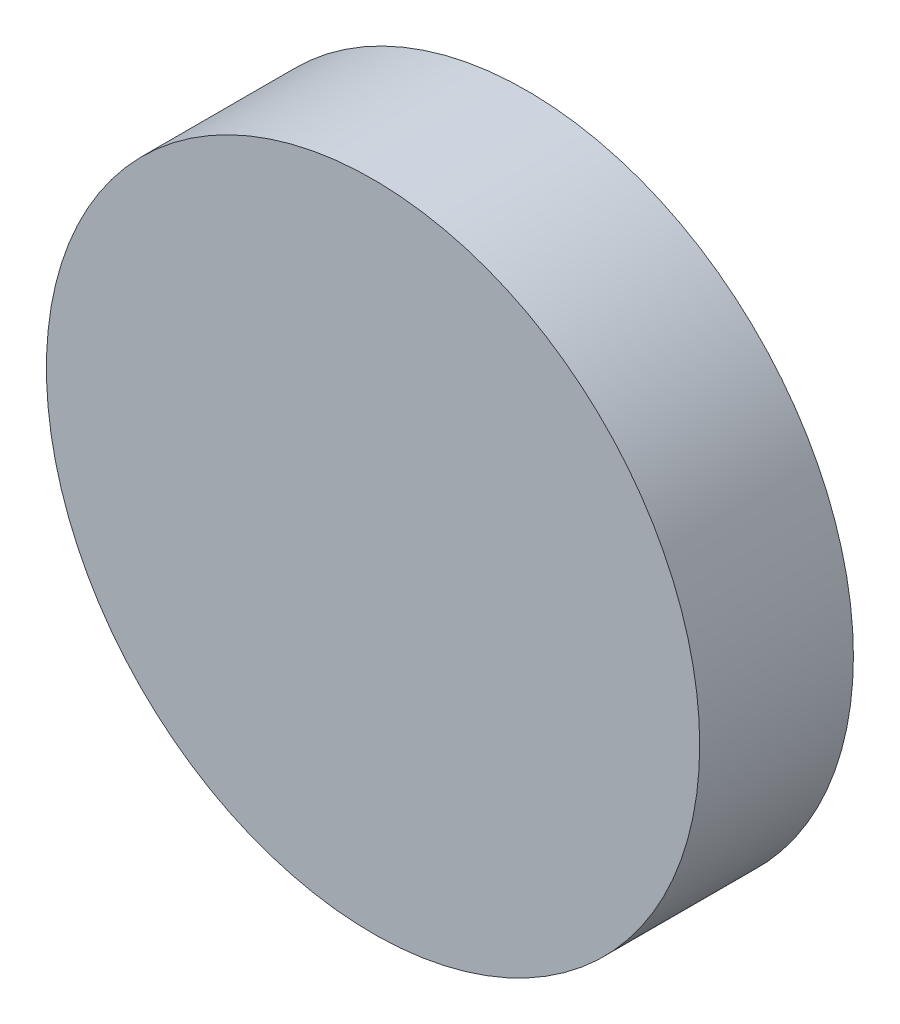
from build123d import *

# Parameters (mm, degrees)
SKETCH1_R           = 4.25
BOSS_EXTRUDE1_DEPTH = 2


with BuildPart() as part:
    # Sketch1 → Boss-Extrude1 (new body)
    with BuildSketch(Plane.XY):
        Circle(SKETCH1_R)
    extrude(amount=BOSS_EXTRUDE1_DEPTH)


solid = part.part
